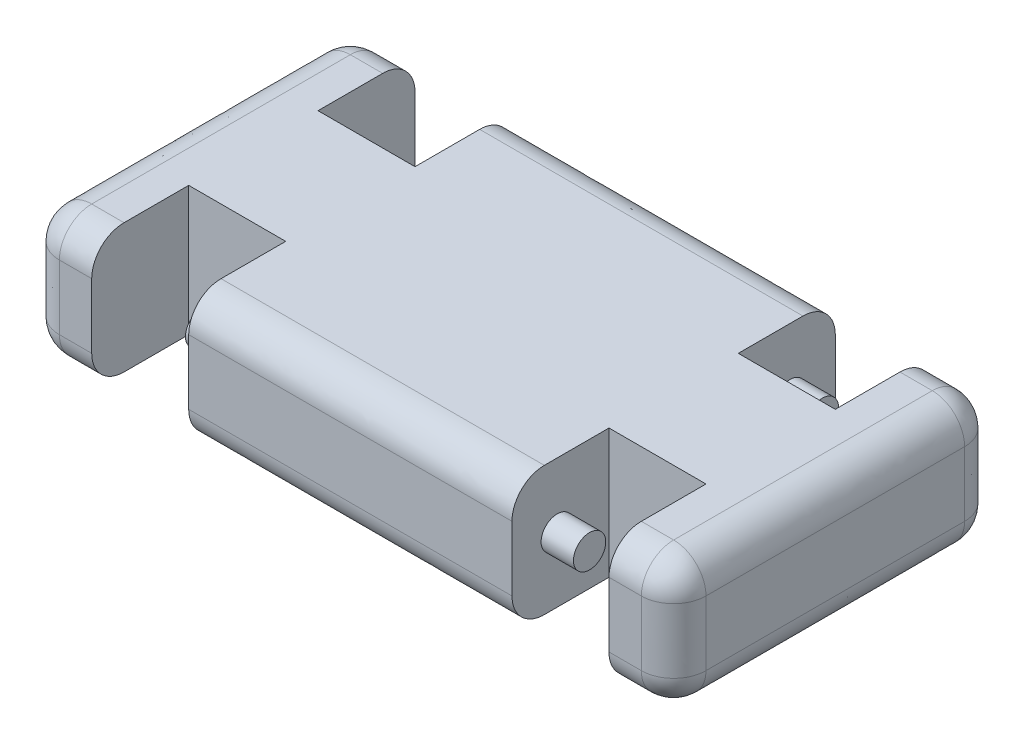
from build123d import *

# Parameters (mm, degrees)
BOSS_EXTRUDE1_DEPTH                        = 100
BOSS_EXTRUDE1_DEPTH_BACK                   = 100
SKETCH1_W                                  = 1000
SKETCH1_H                                  = 500
VARFILLET2_R                               = 50
SKETCH2_W                                  = 150
SKETCH2_H                                  = 250
CUT_EXTRUDE3_DEPTH                         = 230
SKETCH3_R                                  = 25
BOSS_EXTRUDE2_DEPTH                        = 50
MIRROR1_AT_THE_SECOND_PLANE_COPY_1_SKETC_R = 25
MIRROR1_AT_THE_SECOND_PLANE_COPY_1_DEPTH   = 50


with BuildPart() as part:
    # Sketch1 → Boss-Extrude1 (new, two sides: drawn at the far end of the back side and taken through both)
    with BuildSketch(Plane(origin=(0, 0, 0), x_dir=(1, 0, 0), z_dir=(0, 1, 0)).offset(-BOSS_EXTRUDE1_DEPTH_BACK)):
        Rectangle(SKETCH1_W, SKETCH1_H)
    extrude(amount=BOSS_EXTRUDE1_DEPTH + BOSS_EXTRUDE1_DEPTH_BACK)

    # VarFillet2
    varfillet2_edges = [part.edges().sort_by_distance(p)[0] for p in [
        (500, 0, -250),
        (500, -100, 0),
        (500, 0, 250),
        (500, 100, 0),
        (0, -100, 250),
        (0, 100, 250),
        (-500, 0, 250),
        (-500, -100, 0),
        (0, -100, -250),
        (-500, 0, -250),
        (-500, 100, 0),
        (0, 100, -250),
    ]]
    fillet(varfillet2_edges, radius=VARFILLET2_R)

    # Sketch2 → Cut-Extrude3 (cut)
    with BuildSketch(Plane(origin=(0, 100, 0), x_dir=(1, 0, 0), z_dir=(0, 1, 0))):
        with Locations((-325, 225)):
            Rectangle(SKETCH2_W, SKETCH2_H)
        with Locations((-325, -225)):
            Rectangle(SKETCH2_W, SKETCH2_H)
        with Locations((325, -225)):
            Rectangle(SKETCH2_W, SKETCH2_H)
        with Locations((325, 225)):
            Rectangle(SKETCH2_W, SKETCH2_H)
    extrude(amount=-CUT_EXTRUDE3_DEPTH, mode=Mode.SUBTRACT)

    # Sketch3 → Boss-Extrude2 (add)
    with BuildSketch(Plane.ZY.offset(250)):
        with Locations((-180, 0)):
            Circle(SKETCH3_R)
    boss_extrude2 = extrude(amount=BOSS_EXTRUDE2_DEPTH)

    # Mirror1: Boss-Extrude2 across plane
    add(boss_extrude2.mirror(Plane.XY))

    # Mirror1 at the second plane: Boss-Extrude2 across plane
    add(boss_extrude2.mirror(Plane(origin=(0, 0, 0), x_dir=(0, 0, 1), z_dir=(1, 0, 0))))

    # Mirror1 at the second plane copy 1 sketc → Mirror1 at the second plane copy 1 (add)
    with BuildSketch(Plane(origin=(250, 0, 0), x_dir=(0, 0, -1), z_dir=(1, 0, 0))):
        with Locations((-180, 0)):
            Circle(MIRROR1_AT_THE_SECOND_PLANE_COPY_1_SKETC_R)
    extrude(amount=MIRROR1_AT_THE_SECOND_PLANE_COPY_1_DEPTH)


solid = part.part
